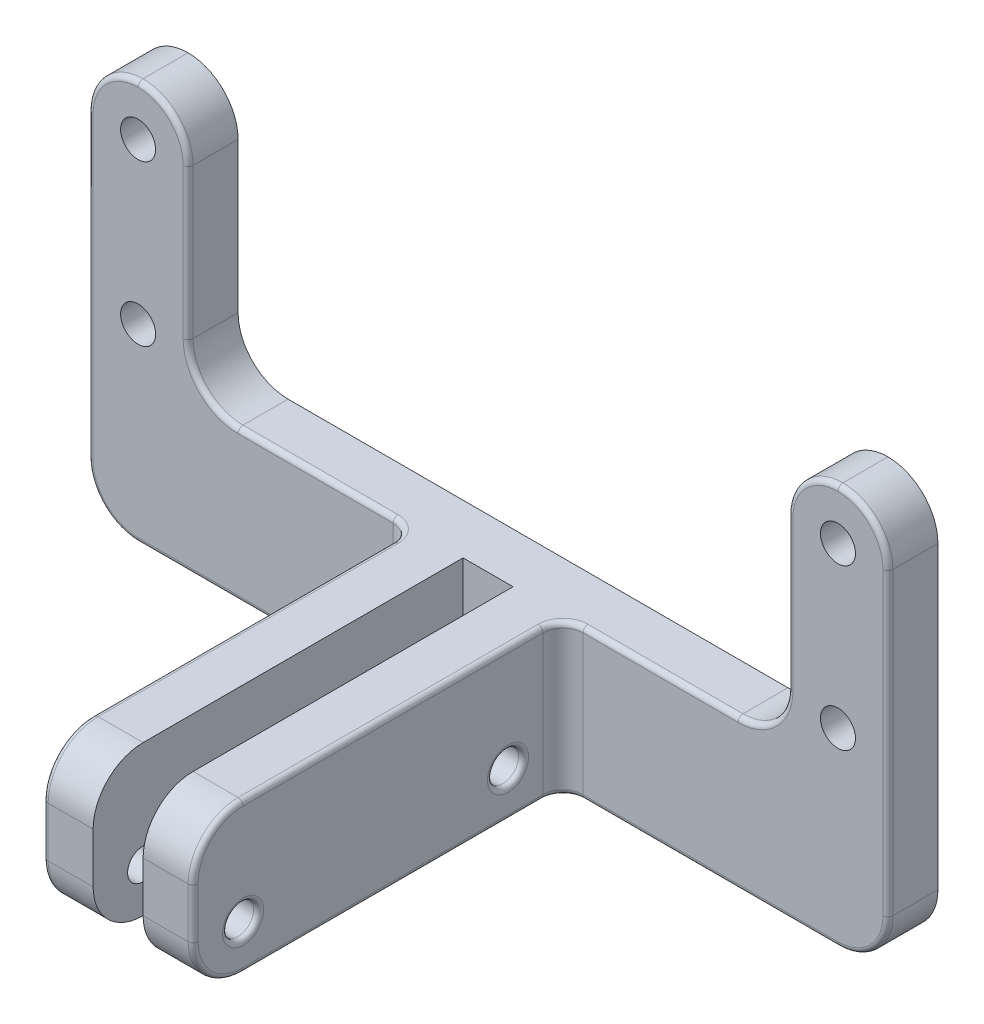
from build123d import *

# Parameters (mm, degrees)
SKETCH_1_W          = 80
SKETCH_1_H          = 40
EXTRUDE_1_DEPTH     = 5
SKETCH_2_R          = 1.75
CUT_EXTRUDE_1_DEPTH = 46
SKETCH_3_W          = 5
SKETCH_3_H          = 15
EXTRUDE_2_DEPTH     = 37
SKETCH_4_R          = 1.55
CUT_EXTRUDE_2_DEPTH = 67.484960705
SKETCH_5_W          = 60
SKETCH_5_H          = 25
CUT_EXTRUDE_3_DEPTH = 5
FILLET_1_R          = 5
FILLET_2_R          = 5
FILLET_3_R          = 2
FILLET_4_R          = 0.5


with BuildPart() as part:
    # ｽｹｯﾁ1 → ﾎﾞｽ - 押し出し1 (new body)
    with BuildSketch(Plane.XY):
        Rectangle(SKETCH_1_W, SKETCH_1_H)
    extrude(amount=EXTRUDE_1_DEPTH)

    # ｽｹｯﾁ2 → ｶｯﾄ - 押し出し1 (cut, through all)
    with BuildSketch(Plane.XY):
        with Locations((35, 15)):
            Circle(SKETCH_2_R)
        with Locations((35, -1)):
            Circle(SKETCH_2_R)
        with Locations(Location((-35, 15, 0), (0, 0, 180))):
            Circle(SKETCH_2_R)
        with Locations(Location((-35, -1, 0), (0, 0, 180))):
            Circle(SKETCH_2_R)
    extrude(amount=CUT_EXTRUDE_1_DEPTH, mode=Mode.SUBTRACT)

    # ｽｹｯﾁ3 → ﾎﾞｽ - 押し出し2 (add)
    with BuildSketch(Plane.XY.offset(5)):
        with Locations((5, -12.5)):
            Rectangle(SKETCH_3_W, SKETCH_3_H)
        with Locations((-5, -12.5)):
            Rectangle(SKETCH_3_W, SKETCH_3_H)
    extrude(amount=EXTRUDE_2_DEPTH)

    # ｽｹｯﾁ4 → ｶｯﾄ - 押し出し2 (cut, through all)
    with BuildSketch(Plane.ZY.offset(7.5)):
        with Locations(Location((10.5, -15.5, 0), (0, 0, 90))):
            Circle(SKETCH_4_R)
        with Locations(Location((37, -15.5, 0), (0, 0, 90))):
            Circle(SKETCH_4_R)
    extrude(amount=-CUT_EXTRUDE_2_DEPTH, mode=Mode.SUBTRACT)

    # ｽｹｯﾁ5 → ｶｯﾄ - 押し出し3 (cut)
    with BuildSketch(Plane.XY):
        with Locations((0, 7.5)):
            Rectangle(SKETCH_5_W, SKETCH_5_H)
    extrude(amount=CUT_EXTRUDE_3_DEPTH, mode=Mode.SUBTRACT)

    # ﾌｨﾚｯﾄ1
    fillet_1_edges = [part.edges().sort_by_distance(p)[0] for p in [
        (5, -5, 42),
        (-5, -5, 42),
        (5, -20, 42),
        (-5, -20, 42),
    ]]
    fillet(fillet_1_edges, radius=FILLET_1_R)

    # ﾌｨﾚｯﾄ2
    fillet_2_edges = [part.edges().sort_by_distance(p)[0] for p in [
        (-30, -5, 2.5),
        (30, -5, 2.5),
        (30, 20, 2.5),
        (40, 20, 2.5),
        (40, -20, 2.5),
        (-40, -20, 2.5),
        (-30, 20, 2.5),
        (-40, 20, 2.5),
    ]]
    fillet(fillet_2_edges, radius=FILLET_2_R - 0.0001)  # a hair under: the kernel refuses the full size

    # ﾌｨﾚｯﾄ3
    fillet_3_edges = [part.edges().sort_by_distance(p)[0] for p in [
        (7.5, -12.5, 5),
        (-7.5, -12.5, 5),
    ]]
    fillet(fillet_3_edges, radius=FILLET_3_R)

    # ﾌｨﾚｯﾄ4
    fillet_4_edges = [part.edges().sort_by_distance(p)[0] for p in [
        (-7.5, -12.5, 42),
        (-7.5, -20, 22),
        (-7.5, -18.535533906, 40.535533906),
        (-7.5, -6.464466094, 40.535533906),
        (-30, 7.5, 5),
        (-17.25005, -5, 5),
        (30, 7.5, 5),
        (40, 0, 5),
        (38.535563195, -18.535563195, 5),
        (38.535563195, 18.535563195, 5),
        (31.464436805, 18.535563195, 5),
        (-22.25005, -20, 5),
        (-40, 0, 5),
        (-38.535563195, 18.535563195, 5),
        (-31.464436805, 18.535563195, 5),
        (-38.535563195, -18.535563195, 5),
        (-28.535563195, -3.535563195, 5),
        (28.535563195, -3.535563195, 5),
        (17.25005, -5, 5),
        (22.25005, -20, 5),
        (8.085786438, -5, 5.585786438),
        (8.085786438, -20, 5.585786438),
        (-8.085786438, -20, 5.585786438),
        (-8.085786438, -5, 5.585786438),
        (7.5, -17.05, 10.5),
        (-7.5, -17.05, 10.5),
        (7.5, -17.05, 37),
        (-7.5, -17.05, 37),
        (7.5, -12.5, 42),
        (7.5, -5, 22),
        (-7.5, -5, 22),
        (7.5, -20, 22),
        (7.5, -18.535533906, 40.535533906),
        (7.5, -6.464466094, 40.535533906),
    ]]
    fillet(fillet_4_edges, radius=FILLET_4_R)


solid = part.part
